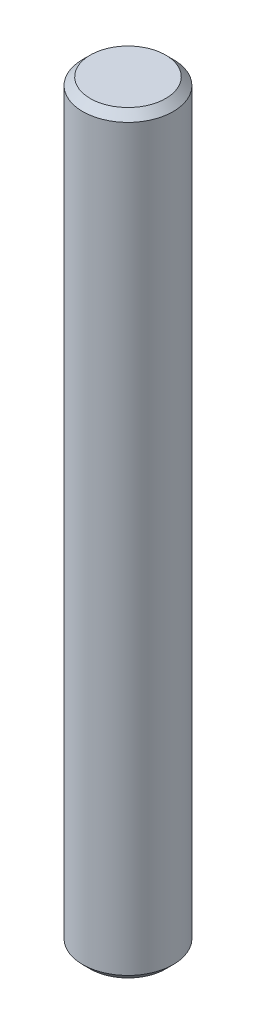
from build123d import *

# Parameters (mm, degrees)
EXTRUDE_1_DEPTH      = 25
EXTRUDE_1_DEPTH_BACK = 25
SKETCH_1_R           = 3
CHAMFER_1_SIZE       = 0.5


with BuildPart() as part:
    # Эскиз1 → Бобышка-Вытянуть1 (new, two sides: drawn at the far end of the back side and taken through both)
    with BuildSketch(Plane(origin=(0, 0, 0), x_dir=(1, 0, 0), z_dir=(0, 1, 0)).offset(-EXTRUDE_1_DEPTH_BACK)):
        Circle(SKETCH_1_R)
    extrude(amount=EXTRUDE_1_DEPTH + EXTRUDE_1_DEPTH_BACK)

    # Фаска1
    chamfer_1_edges = [part.edges().sort_by_distance(p)[0] for p in [
        (-3, 25, 0),
        (-3, -25, 0),
    ]]
    chamfer(chamfer_1_edges, length=CHAMFER_1_SIZE)


solid = part.part
